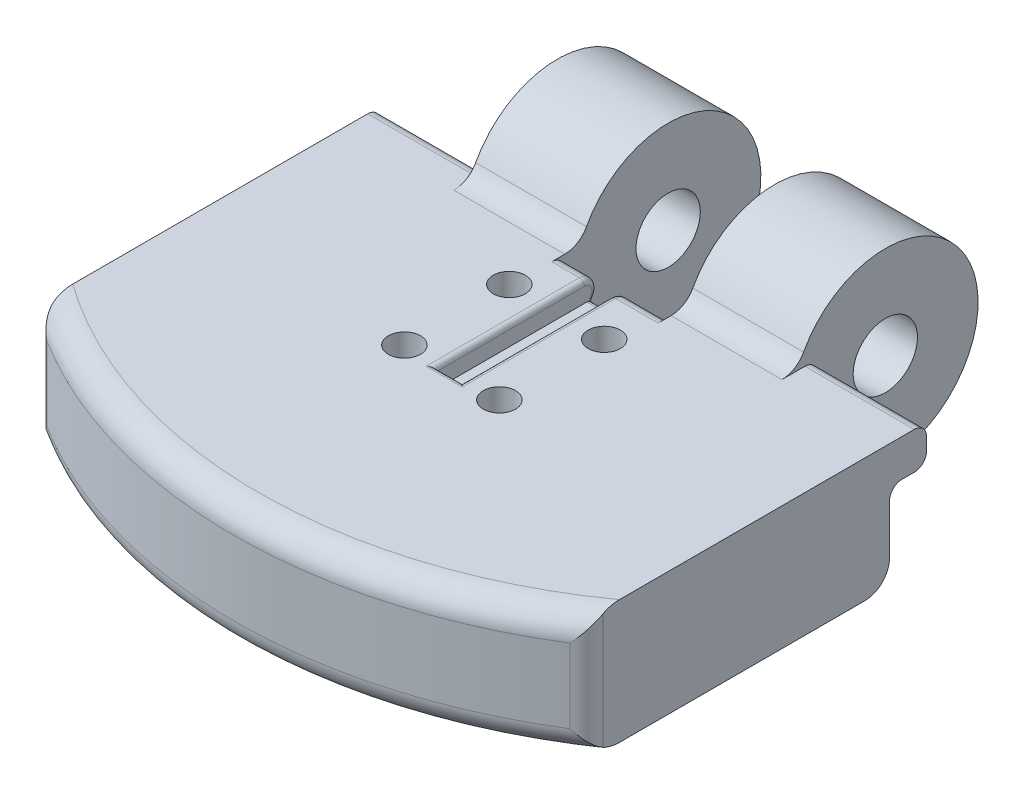
from build123d import *

# Parameters (mm, degrees)
BOSS_EXTRUDE1_DEPTH = 12.7
BOSS_EXTRUDE2_DEPTH = 11.3792
SKETCH5_R           = 3.302
CUT_EXTRUDE2_DEPTH  = 64.793728496
SKETCH7_W           = 11.7348
SKETCH7_H           = 1.27
CUT_EXTRUDE4_DEPTH  = 52.205639625
CUT_EXTRUDE5_DEPTH  = 10.922
FILLET3_R           = 1.27
SKETCH13_R          = 1.651
CUT_EXTRUDE9_DEPTH  = 52.205639625
SKETCH14_R          = 2.032
CUT_EXTRUDE10_DEPTH = 4.699
SKETCH19_W          = 11.7348
SKETCH19_H          = 3.81
BOSS_EXTRUDE3_DEPTH = 3.81
FILLET8_R           = 1.27
FILLET9_R           = 1.27
FILLET10_R          = 2.54
SKETCH20_W          = 2.682873679
SKETCH20_H          = 16.51
CUT_EXTRUDE11_DEPTH = 2.032
FILLET11_R          = 0.508
SKETCH23_W          = 0.508
SKETCH23_H          = 34.631153121
CUT_EXTRUDE12_DEPTH = 52.205639625
FILLET12_R          = 2.54
FILLET13_R          = 2.54


with BuildPart() as part:
    # Sketch1 → Boss-Extrude1 (new body)
    with BuildSketch(Plane(origin=(0, 0, 0), x_dir=(1, 0, 0), z_dir=(0, 1, 0))):
        with BuildLine():
            Line((-28.575, 0), (28.575, 0))
            Line((28.575, 0), (28.575, -31.75))
            ThreePointArc((28.575, -31.75), (0, -40.548697937), (-28.575, -31.75))
            Line((-28.575, -31.75), (-28.575, 0))
        make_face()
    extrude(amount=BOSS_EXTRUDE1_DEPTH)

    # Sketch2 → Boss-Extrude2 (add)
    with BuildSketch(Plane.ZY.offset(16.8402)):
        with BuildLine():
            Line((0, 12.7), (-0.544743879, 12.7))
            ThreePointArc((-0.544743879, 12.7), (-17.302129933, 15.024261314), (-9.525, 0))
            Line((-9.525, 0), (0, 0))
            Line((0, 0), (0, 12.7))
        make_face()
    boss_extrude2 = extrude(amount=-BOSS_EXTRUDE2_DEPTH)

    # Mirror1: Boss-Extrude2 across plane
    add(boss_extrude2.mirror(Plane(origin=(0, 0, 0), x_dir=(0, 0, 1), z_dir=(1, 0, 0))))

    # Sketch5 → Cut-Extrude2 (cut, through all)
    with BuildSketch(Plane.ZY.offset(16.8402)):
        with Locations((-9.525, 9.525)):
            Circle(SKETCH5_R)
    extrude(amount=-CUT_EXTRUDE2_DEPTH, mode=Mode.SUBTRACT)

    # Sketch7 → Cut-Extrude4 (cut, through all)
    with BuildSketch(Plane(origin=(0, 12.7, 0), x_dir=(1, 0, 0), z_dir=(0, 1, 0))):
        with Locations((-22.7076, -0.635)):
            Rectangle(SKETCH7_W, SKETCH7_H)
        with Locations((22.7076, -0.635)):
            Rectangle(SKETCH7_W, SKETCH7_H)
    extrude(amount=-CUT_EXTRUDE4_DEPTH, mode=Mode.SUBTRACT)

    # Sketch8 → Cut-Extrude5 (cut)
    with BuildSketch(Plane.ZY.offset(-5.461)):
        with BuildLine():
            Line((0, 12.7), (0, 0))
            ThreePointArc((0, 0), (2.425484171, 6.35), (0, 12.7))
        make_face()
    extrude(amount=CUT_EXTRUDE5_DEPTH, mode=Mode.SUBTRACT)

    # Fillet3
    fillet3_edges = [part.edges().sort_by_distance(p)[0] for p in [
        (0, 0, 0),
        (0, 12.7, 0),
    ]]
    fillet(fillet3_edges, radius=FILLET3_R)

    # Sketch13 → Cut-Extrude9 (cut, through all)
    with BuildSketch(Plane(origin=(0, 12.7, 0), x_dir=(1, 0, 0), z_dir=(0, 1, 0))):
        with Locations(Location((-5.61509026, -6.634627892, 0), (0, 0, 270))):
            Circle(SKETCH13_R)
        with Locations(Location((4.13850974, -6.634627892, 0), (0, 0, 270))):
            Circle(SKETCH13_R)
        with Locations(Location((-5.61509026, -17.404227892, 0), (0, 0, 270))):
            Circle(SKETCH13_R)
        with Locations(Location((4.13850974, -17.404227892, 0), (0, 0, 270))):
            Circle(SKETCH13_R)
    extrude(amount=-CUT_EXTRUDE9_DEPTH, mode=Mode.SUBTRACT)

    # Sketch14 → Cut-Extrude10 (cut)
    with BuildSketch(Plane.XZ):
        with Locations(Location((-5.61509026, 17.404227892, 0), (0, 0, 270))):
            Circle(SKETCH14_R)
        with Locations(Location((4.13850974, 17.404227892, 0), (0, 0, 270))):
            Circle(SKETCH14_R)
        with Locations(Location((-5.61509026, 6.634627892, 0), (0, 0, 270))):
            Circle(SKETCH14_R)
        with Locations(Location((4.13850974, 6.634627892, 0), (0, 0, 270))):
            Circle(SKETCH14_R)
    extrude(amount=-CUT_EXTRUDE10_DEPTH, mode=Mode.SUBTRACT)

    # Sketch19 → Boss-Extrude3 (add)
    with BuildSketch(Plane(origin=(0, 0, 1.27), x_dir=(-1, 0, 0), z_dir=(0, 0, -1))):
        with Locations((-22.7076, 10.795)):
            Rectangle(SKETCH19_W, SKETCH19_H)
    boss_extrude3 = extrude(amount=BOSS_EXTRUDE3_DEPTH)

    # Mirror8: Boss-Extrude3 across plane
    add(boss_extrude3.mirror(Plane(origin=(0, 0, 0), x_dir=(0, 0, 1), z_dir=(1, 0, 0))))

    # Fillet8
    fillet8_edges = [part.edges().sort_by_distance(p)[0] for p in [
        (22.7076, 12.7, -2.54),
        (-22.7076, 12.7, -2.54),
    ]]
    fillet(fillet8_edges, radius=FILLET8_R)

    # Fillet9
    fillet9_edges = [part.edges().sort_by_distance(p)[0] for p in [
        (22.7076, 8.89, 1.27),
        (22.7076, 8.89, -2.54),
        (-22.7076, 8.89, -2.54),
        (-22.7076, 8.89, 1.27),
    ]]
    fillet(fillet9_edges, radius=FILLET9_R)

    # Fillet10
    fillet10_edges = [part.edges().sort_by_distance(p)[0] for p in [
        (-22.7076, 0, 1.27),
        (22.7076, 0, 1.27),
    ]]
    fillet(fillet10_edges, radius=FILLET10_R)

    # Sketch20 → Cut-Extrude11 (cut)
    with BuildSketch(Plane(origin=(0, 12.7, 0), x_dir=(1, 0, 0), z_dir=(0, 1, 0))):
        with Locations((-0.764656954, -9.410484171)):
            Rectangle(SKETCH20_W, SKETCH20_H)
    extrude(amount=-CUT_EXTRUDE11_DEPTH, mode=Mode.SUBTRACT)

    # Fillet11
    # the kernel refuses this fillet: 0.508 mm, written as the material it takes off along each edge
    with BuildSketch(Plane(origin=(-2.106093794, 11.43, 2.425484171), x_dir=(0, -0.47058823529411886, -0.8823529411764699), z_dir=(0, -0.8823529411764699, 0.47058823529411886))) as fillet11_piece_1:
        with BuildLine():
            CenterArc((1.27 - FILLET11_R, -FILLET11_R), FILLET11_R, 0, 90)
            Line((1.27 - FILLET11_R, 0), (1.27, 0))
            Line((1.27, 0), (1.27, -FILLET11_R))
        make_face()
    revolve(axis=Axis((-2.106093794, 11.43, 2.425484171), (1, 0, 0)), revolution_arc=118.072486936, mode=Mode.SUBTRACT)
    with BuildSketch(Plane(origin=(0.576779885, 11.43, 2.425484171), x_dir=(0, -0.4705882352941178, -0.8823529411764706), z_dir=(0, -0.8823529411764706, 0.4705882352941178))) as fillet11_piece_2:
        with BuildLine():
            CenterArc((1.27 - FILLET11_R, FILLET11_R), FILLET11_R, 270, 90)
            Line((1.27, FILLET11_R), (1.27, 0))
            Line((1.27, 0), (1.27 - FILLET11_R, 0))
        make_face()
    revolve(axis=Axis((0.576779885, 11.43, 2.425484171), (1, 0, 0)), revolution_arc=118.072486936, mode=Mode.SUBTRACT)
    with BuildSketch(Plane(origin=(-2.106093794, 10.668, 1.390507787), x_dir=(0, 0, 1), z_dir=(1, 0, 0))) as fillet11_piece_3:
        with BuildLine():
            CenterArc((0.79140887, 0.508), FILLET11_R, 157.681998053, 112.318001947)
            ThreePointArc((0.321462922, 0.700911392), (0.167827306, 0.347201289), (0, 0))
            Line((0, 0), (0.79140887, 0))
        make_face()
    extrude(amount=2.682873679, mode=Mode.SUBTRACT)
    with BuildSketch(Plane(origin=(0.576779885, 6.35, -7.099515829), x_dir=(0, 0.470588235294118, 0.8823529411764705), z_dir=(0, 0.8823529411764705, -0.470588235294118))) as fillet11_piece_4_section:
        with BuildLine():
            CenterArc((9.525 + FILLET11_R, FILLET11_R), FILLET11_R, 180, 90)
            Line((9.525, FILLET11_R), (9.525, 0))
            Line((9.525, 0), (9.525 + FILLET11_R, 0))
        make_face()
    fillet11_piece_4 = revolve(axis=Axis((0.576779885, 6.35, -7.099515829), (1, 0, 0)), revolution_arc=8.754175536, mode=Mode.PRIVATE)
    fillet11_piece_4 = split(fillet11_piece_4, bisect_by=Plane(origin=(0.676628011, 10.668, 1.488948355), z_dir=(0, 1, 0)), keep=Keep.TOP, mode=Mode.PRIVATE)
    add(fillet11_piece_4, mode=Mode.SUBTRACT)
    with BuildSketch(Plane(origin=(-2.106093794, 6.35, -7.099515829), x_dir=(0, 0.470588235294118, 0.8823529411764705), z_dir=(0, 0.8823529411764705, -0.470588235294118))) as fillet11_piece_5_section:
        with BuildLine():
            CenterArc((9.525 + FILLET11_R, -FILLET11_R), FILLET11_R, 90, 90)
            Line((9.525, -FILLET11_R), (9.525, 0))
            Line((9.525, 0), (9.525 + FILLET11_R, 0))
        make_face()
    fillet11_piece_5 = revolve(axis=Axis((-2.106093794, 6.35, -7.099515829), (1, 0, 0)), revolution_arc=8.754175536, mode=Mode.PRIVATE)
    fillet11_piece_5 = split(fillet11_piece_5, bisect_by=Plane(origin=(-2.205941921, 10.668, 1.488948355), z_dir=(0, 1, 0)), keep=Keep.TOP, mode=Mode.PRIVATE)
    add(fillet11_piece_5, mode=Mode.SUBTRACT)
    with BuildSketch(Plane(origin=(0.576779885, 12.7, 2.425484171), x_dir=(0, -1, 0), z_dir=(0, 0, 1)), Plane(origin=(-2.106093794, 12.7, 17.665484171), x_dir=(0, -1, 0), z_dir=(0, 0, -1))) as fillet11_piece_6:
        with BuildLine():
            CenterArc((FILLET11_R, FILLET11_R), FILLET11_R, 180, 90)
            Line((0, FILLET11_R), (0, 0))
            Line((0, 0), (FILLET11_R, 0))
        make_face()
    extrude(amount=15.24, mode=Mode.SUBTRACT)
    with BuildSketch(Plane(origin=(0.576779885, 12.7, 17.665484171), x_dir=(0, -1, 0), z_dir=(-1, 0, 0))) as fillet11_piece_7:
        with BuildLine():
            CenterArc((FILLET11_R, FILLET11_R), FILLET11_R, 180, 90)
            Line((0, FILLET11_R), (0, 0))
            Line((0, 0), (FILLET11_R, 0))
        make_face()
    extrude(amount=2.682873679, mode=Mode.SUBTRACT)
    with BuildSketch(Plane(origin=(-2.106093794, 6.35, -7.099515829), x_dir=(0, 0.470588235294118, 0.8823529411764705), z_dir=(0, 0.8823529411764705, -0.470588235294118))) as fillet11_piece_8a_section:
        with BuildLine():
            CenterArc((9.525 + FILLET11_R, -FILLET11_R), FILLET11_R, 90, 90)
            Line((9.525, -FILLET11_R), (9.525, 0))
            Line((9.525, 0), (9.525 + FILLET11_R, 0))
        make_face()
    fillet11_piece_8a = revolve(axis=Axis((-2.106093794, 6.35, -7.099515829), (1, 0, 0)), revolution_arc=8.754175536, mode=Mode.PRIVATE)
    fillet11_piece_8a = split(fillet11_piece_8a, bisect_by=Plane(origin=(-2.22325823, 10.668, 1.766715052), z_dir=(0, -1, 0)), keep=Keep.TOP, mode=Mode.PRIVATE)
    with BuildSketch(Plane(origin=(-4.08461597, 10.668, 1.390507787), x_dir=(0, 0, 1), z_dir=(1, 0, 0))) as fillet11_piece_8b_section:
        with BuildLine():
            CenterArc((0.79140887, 0.508), FILLET11_R, 157.681998053, 112.318001947)
            ThreePointArc((0.321462922, 0.700911392), (0.167827306, 0.347201289), (0, 0))
            Line((0, 0), (0.79140887, 0))
        make_face()
    fillet11_piece_8b = extrude(amount=4.661395855, mode=Mode.PRIVATE)
    fillet11_piece_8b = split(fillet11_piece_8b, bisect_by=Plane(origin=(-2.106093794, 10.500136053, 1.663831892), z_dir=(-1, 0, 0)), keep=Keep.TOP, mode=Mode.PRIVATE)
    fillet11_piece_8 = fillet11_piece_8a & fillet11_piece_8b
    add(fillet11_piece_8, mode=Mode.SUBTRACT)
    with BuildSketch(Plane(origin=(-2.106093794, 10.668, 1.390507787), x_dir=(0, 0, 1), z_dir=(1, 0, 0))) as fillet11_piece_9a_section:
        with BuildLine():
            CenterArc((0.79140887, 0.508), FILLET11_R, 157.681998053, 112.318001947)
            ThreePointArc((0.321462922, 0.700911392), (0.167827306, 0.347201289), (0, 0))
            Line((0, 0), (0.79140887, 0))
        make_face()
    fillet11_piece_9a = extrude(amount=4.661395855, mode=Mode.PRIVATE)
    fillet11_piece_9a = split(fillet11_piece_9a, bisect_by=Plane(origin=(0.576779885, 10.500136053, 1.663831892), z_dir=(1, 0, 0)), keep=Keep.TOP, mode=Mode.PRIVATE)
    with BuildSketch(Plane(origin=(0.576779885, 6.35, -7.099515829), x_dir=(0, 0.470588235294118, 0.8823529411764705), z_dir=(0, 0.8823529411764705, -0.470588235294118))) as fillet11_piece_9b_section:
        with BuildLine():
            CenterArc((9.525 + FILLET11_R, FILLET11_R), FILLET11_R, 180, 90)
            Line((9.525, FILLET11_R), (9.525, 0))
            Line((9.525, 0), (9.525 + FILLET11_R, 0))
        make_face()
    fillet11_piece_9b = revolve(axis=Axis((0.576779885, 6.35, -7.099515829), (1, 0, 0)), revolution_arc=8.754175536, mode=Mode.PRIVATE)
    fillet11_piece_9b = split(fillet11_piece_9b, bisect_by=Plane(origin=(0.69394432, 10.668, 1.766715054), z_dir=(0, -1, 0)), keep=Keep.TOP, mode=Mode.PRIVATE)
    fillet11_piece_9 = fillet11_piece_9a & fillet11_piece_9b
    add(fillet11_piece_9, mode=Mode.SUBTRACT)
    with BuildSketch(Plane(origin=(0.576779885, 12.7, 2.425484171), x_dir=(0, -1, 0), z_dir=(0, 0, 1))) as fillet11_piece_10a_section:
        with BuildLine():
            CenterArc((FILLET11_R, FILLET11_R), FILLET11_R, 180, 90)
            Line((0, FILLET11_R), (0, 0))
            Line((0, 0), (FILLET11_R, 0))
        make_face()
    fillet11_piece_10a = extrude(amount=16.51, mode=Mode.PRIVATE)
    fillet11_piece_10a = split(fillet11_piece_10a, bisect_by=Plane(origin=(0.691788603, 12.584991282, 17.665484171), z_dir=(0, 0, 1)), keep=Keep.TOP, mode=Mode.PRIVATE)
    with BuildSketch(Plane(origin=(1.846779885, 12.7, 17.665484171), x_dir=(0, -1, 0), z_dir=(-1, 0, 0))) as fillet11_piece_10b_section:
        with BuildLine():
            CenterArc((FILLET11_R, FILLET11_R), FILLET11_R, 180, 90)
            Line((0, FILLET11_R), (0, 0))
            Line((0, 0), (FILLET11_R, 0))
        make_face()
    fillet11_piece_10b = extrude(amount=3.952873679, mode=Mode.PRIVATE)
    fillet11_piece_10b = split(fillet11_piece_10b, bisect_by=Plane(origin=(0.576779885, 12.584991282, 17.780492889), z_dir=(1, 0, 0)), keep=Keep.TOP, mode=Mode.PRIVATE)
    fillet11_piece_10 = fillet11_piece_10a & fillet11_piece_10b
    add(fillet11_piece_10, mode=Mode.SUBTRACT)
    with BuildSketch(Plane(origin=(-2.106093794, 12.7, 18.935484171), x_dir=(0, -1, 0), z_dir=(0, 0, -1))) as fillet11_piece_11a_section:
        with BuildLine():
            CenterArc((FILLET11_R, FILLET11_R), FILLET11_R, 180, 90)
            Line((0, FILLET11_R), (0, 0))
            Line((0, 0), (FILLET11_R, 0))
        make_face()
    fillet11_piece_11a = extrude(amount=16.51, mode=Mode.PRIVATE)
    fillet11_piece_11a = split(fillet11_piece_11a, bisect_by=Plane(origin=(-2.221102512, 12.584991282, 17.665484171), z_dir=(0, 0, 1)), keep=Keep.TOP, mode=Mode.PRIVATE)
    with BuildSketch(Plane(origin=(0.576779885, 12.7, 17.665484171), x_dir=(0, -1, 0), z_dir=(-1, 0, 0))) as fillet11_piece_11b_section:
        with BuildLine():
            CenterArc((FILLET11_R, FILLET11_R), FILLET11_R, 180, 90)
            Line((0, FILLET11_R), (0, 0))
            Line((0, 0), (FILLET11_R, 0))
        make_face()
    fillet11_piece_11b = extrude(amount=3.952873679, mode=Mode.PRIVATE)
    fillet11_piece_11b = split(fillet11_piece_11b, bisect_by=Plane(origin=(-2.106093794, 12.584991282, 17.780492889), z_dir=(-1, 0, 0)), keep=Keep.TOP, mode=Mode.PRIVATE)
    fillet11_piece_11 = fillet11_piece_11a & fillet11_piece_11b
    add(fillet11_piece_11, mode=Mode.SUBTRACT)

    # Sketch23 → Cut-Extrude12 (cut, through all)
    with BuildSketch(Plane(origin=(0, 12.7, 0), x_dir=(1, 0, 0), z_dir=(0, 1, 0))):
        with Locations((-28.321, -14.775576561)):
            Rectangle(SKETCH23_W, SKETCH23_H)
        with Locations((28.321, -14.775576561)):
            Rectangle(SKETCH23_W, SKETCH23_H)
    extrude(amount=-CUT_EXTRUDE12_DEPTH, mode=Mode.SUBTRACT)

    # Fillet12
    fillet12_edges = [part.edges().sort_by_distance(p)[0] for p in [
        (0, 0, 40.548697937),
        (0, 12.7, 40.548697937),
        (-28.067, 6.35, 32.091153121),
        (28.067, 6.35, 32.091153121),
    ]]
    fillet(fillet12_edges, radius=FILLET12_R)

    # Fillet13
    fillet13_edges = [part.edges().sort_by_distance(p)[0] for p in [
        (-11.1506, 12.7, -0.544743879),
        (11.1506, 12.7, -0.544743879),
    ]]
    fillet(fillet13_edges, radius=FILLET13_R)


solid = part.part
